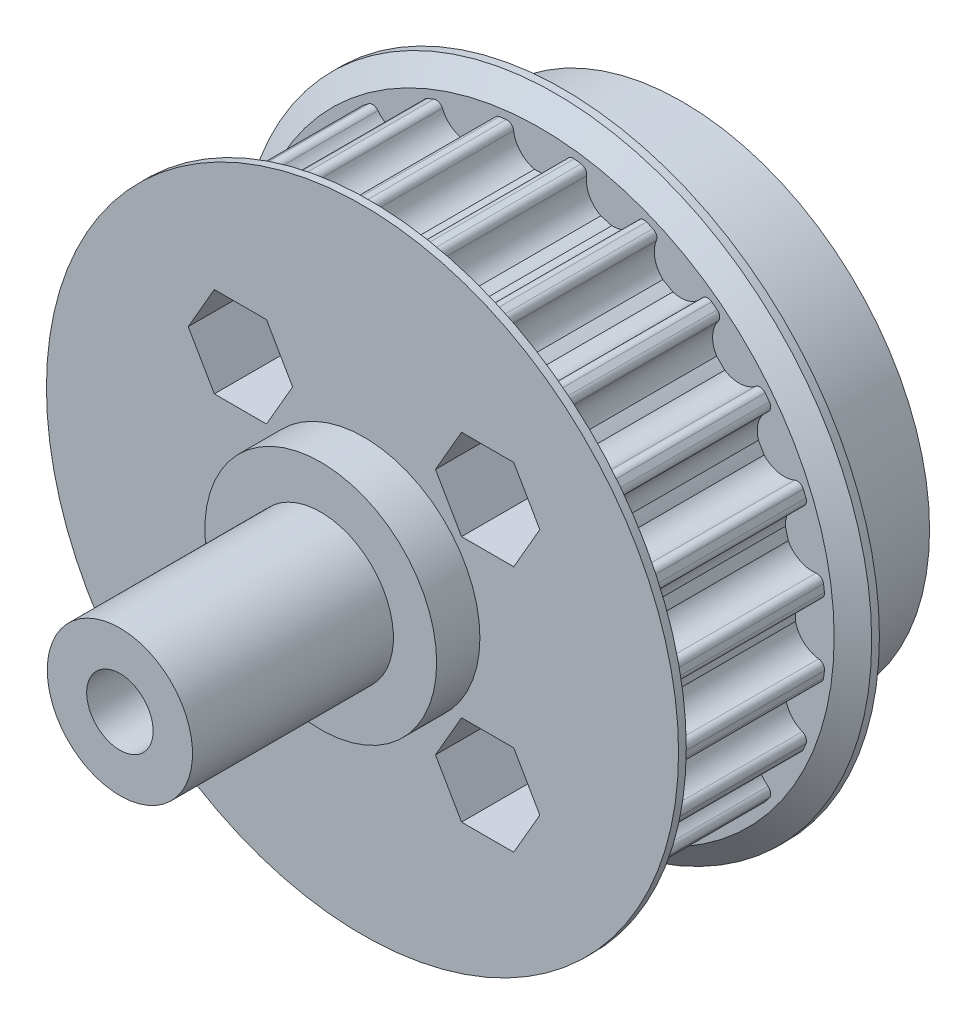
from build123d import *

# Parameters (mm, degrees)
BOSS_EXTRUDE1_START       = -6.5
BOSS_EXTRUDE1_OUTLINE_R   = 0.1
BOSS_EXTRUDE1_DEPTH       = 13
BOSS_EXTRUDE1_START_2     = 6.5
BOSS_EXTRUDE1_2_OUTLINE_R = 7.5
BOSS_EXTRUDE1_2_DEPTH     = 2.8
BOSS_EXTRUDE1_START_3     = 5.9999999
BOSS_EXTRUDE1_3_OUTLINE_R = 20.454976178
BOSS_EXTRUDE1_3_DEPTH     = 0.5000001
BOSS_EXTRUDE1_4_OUTLINE_R = 20.454976178
BOSS_EXTRUDE1_4_DEPTH     = 0.4999999
BOSS_EXTRUDE2_START       = 9.3
SKETCH1_6_R               = 4.7
SKETCH1_6_R_2             = 2.15
BOSS_EXTRUDE2_DEPTH       = 13
CUT_EXTRUDE1_START        = 22.3
SKETCH1_7_R               = 2.15
CUT_EXTRUDE1_DEPTH        = 10
BOSS_EXTRUDE3_START       = -6.5
SKETCH2_R                 = 16
SKETCH2_W                 = 9.7
SKETCH2_H                 = 9.7
SKETCH2_R_2               = 1.825
BOSS_EXTRUDE3_DEPTH       = 7.6
CUT_EXTRUDE2_DEPTH        = 37.525362433
CUT_EXTRUDE2_DEPTH_BACK   = 37.525362433
SKETCH2_3_R               = 1.825
CUT_EXTRUDE3_START        = 6.5
SKETCH2_4_R               = 1.825
CUT_EXTRUDE3_DEPTH        = 12
CUT_EXTRUDE4_START        = -14.1
SKETCH2_5_W               = 9.7
SKETCH2_5_H               = 9.7
CUT_EXTRUDE4_DEPTH        = 15


with BuildPart() as part:
    # Boss-Extrude1: read off the stored shape, not the designer's step
    # Boss-Extrude1 outline → Boss-Extrude1 (new body)
    with BuildSketch(Plane.XY.offset(BOSS_EXTRUDE1_START)):
        with BuildLine():
            ThreePointArc((-0.371183717, 16.524459806), (-1.279945959, 17.062327554), (-1.718949637, 18.022757822))
            ThreePointArc((-1.718949637, 18.022757822), (-1.880764747, 18.307950964), (-2.196580999, 18.396151608))
            ThreePointArc((-2.196580999, 18.396151608), (-2.418236335, 18.368328588), (-2.639540076, 18.337834939))
            ThreePointArc((-2.639540076, 18.337834939), (-2.921767144, 18.170900399), (-3.004255122, 17.853544145))
            ThreePointArc((-3.004255122, 17.853544145), (-3.179722466, 16.812217232), (-3.91830897, 16.057471907))
            ThreePointArc((-3.91830897, 16.057471907), (-4.27792376, 15.965428824), (-4.635380846, 15.865333077))
            ThreePointArc((-4.635380846, 15.865333077), (-5.652388183, 16.14966845), (-6.325010818, 16.963750338))
            ThreePointArc((-6.325010818, 16.963750338), (-6.555125629, 17.197344927), (-6.883008709, 17.200800946))
            ThreePointArc((-6.883008709, 17.200800946), (-7.089910196, 17.11655735), (-7.295780858, 17.029825124))
            ThreePointArc((-7.295780858, 17.029825124), (-7.525185432, 16.795532999), (-7.522724858, 16.467640938))
            ThreePointArc((-7.522724858, 16.467640938), (-7.422698061, 15.416382089), (-7.940775375, 14.496193834))
            ThreePointArc((-7.940775375, 14.496193834), (-8.264314086, 14.314211886), (-8.583684431, 14.125010117))
            ThreePointArc((-8.583684431, 14.125010117), (-9.639629493, 14.13643613), (-10.500032964, 14.748691302))
            ThreePointArc((-10.500032964, 14.748691302), (-10.782765532, 14.914768252), (-11.100370751, 14.833244125))
            ThreePointArc((-11.100370751, 14.833244125), (-11.278418392, 14.698321014), (-11.45482623, 14.56126087))
            ThreePointArc((-11.45482623, 14.56126087), (-11.61577477, 14.275577783), (-11.528533327, 13.959495216))
            ThreePointArc((-11.528533327, 13.959495216), (-11.159829049, 12.969945983), (-11.422091061, 11.947024107))
            ThreePointArc((-11.422091061, 11.947024107), (-11.687505063, 11.687505063), (-11.947024107, 11.422091061))
            ThreePointArc((-11.947024107, 11.422091061), (-12.969945983, 11.159829049), (-13.959495216, 11.528533327))
            ThreePointArc((-13.959495216, 11.528533327), (-14.275577783, 11.61577477), (-14.56126087, 11.45482623))
            ThreePointArc((-14.56126087, 11.45482623), (-14.698321014, 11.278418392), (-14.833244125, 11.100370751))
            ThreePointArc((-14.833244125, 11.100370751), (-14.914768252, 10.782765532), (-14.748691302, 10.500032964))
            ThreePointArc((-14.748691302, 10.500032964), (-14.13643613, 9.639629493), (-14.125010117, 8.583684431))
            ThreePointArc((-14.125010117, 8.583684431), (-14.314211886, 8.264314086), (-14.496193834, 7.940775375))
            ThreePointArc((-14.496193834, 7.940775375), (-15.416382089, 7.422698061), (-16.467640938, 7.522724858))
            ThreePointArc((-16.467640938, 7.522724858), (-16.795532999, 7.525185432), (-17.029825124, 7.295780858))
            ThreePointArc((-17.029825124, 7.295780858), (-17.11655735, 7.089910196), (-17.200800946, 6.883008709))
            ThreePointArc((-17.200800946, 6.883008709), (-17.197344927, 6.555125629), (-16.963750338, 6.325010818))
            ThreePointArc((-16.963750338, 6.325010818), (-16.14966845, 5.652388183), (-15.865333077, 4.635380846))
            ThreePointArc((-15.865333077, 4.635380846), (-15.965428824, 4.27792376), (-16.057471907, 3.91830897))
            ThreePointArc((-16.057471907, 3.91830897), (-16.812217232, 3.179722466), (-17.853544145, 3.004255122))
            ThreePointArc((-17.853544145, 3.004255122), (-18.170900399, 2.921767144), (-18.337834939, 2.639540076))
            ThreePointArc((-18.337834939, 2.639540076), (-18.368328588, 2.418236335), (-18.396151608, 2.196580999))
            ThreePointArc((-18.396151608, 2.196580999), (-18.307950964, 1.880764747), (-18.022757822, 1.718949637))
            ThreePointArc((-18.022757822, 1.718949637), (-17.062327554, 1.279945959), (-16.524459806, 0.371183717))
            ThreePointArc((-16.524459806, 0.371183717), (-16.528628171, 0), (-16.524459806, -0.371183717))
            ThreePointArc((-16.524459806, -0.371183717), (-17.062327554, -1.279945959), (-18.022757822, -1.718949637))
            ThreePointArc((-18.022757822, -1.718949637), (-18.307950964, -1.880764747), (-18.396151608, -2.196580999))
            ThreePointArc((-18.396151608, -2.196580999), (-18.368328588, -2.418236335), (-18.337834939, -2.639540076))
            ThreePointArc((-18.337834939, -2.639540076), (-18.170900399, -2.921767144), (-17.853544145, -3.004255122))
            ThreePointArc((-17.853544145, -3.004255122), (-16.812217232, -3.179722466), (-16.057471907, -3.91830897))
            ThreePointArc((-16.057471907, -3.91830897), (-15.965428824, -4.27792376), (-15.865333077, -4.635380846))
            ThreePointArc((-15.865333077, -4.635380846), (-16.14966845, -5.652388183), (-16.963750338, -6.325010818))
            ThreePointArc((-16.963750338, -6.325010818), (-17.197344927, -6.555125629), (-17.200800946, -6.883008709))
            ThreePointArc((-17.200800946, -6.883008709), (-17.11655735, -7.089910196), (-17.029825124, -7.295780858))
            ThreePointArc((-17.029825124, -7.295780858), (-16.795532999, -7.525185432), (-16.467640938, -7.522724858))
            ThreePointArc((-16.467640938, -7.522724858), (-15.416382089, -7.422698061), (-14.496193834, -7.940775375))
            ThreePointArc((-14.496193834, -7.940775375), (-14.314211886, -8.264314086), (-14.125010117, -8.583684431))
            ThreePointArc((-14.125010117, -8.583684431), (-14.13643613, -9.639629493), (-14.748691302, -10.500032964))
            ThreePointArc((-14.748691302, -10.500032964), (-14.914768252, -10.782765532), (-14.833244125, -11.100370751))
            ThreePointArc((-14.833244125, -11.100370751), (-14.698321014, -11.278418392), (-14.56126087, -11.45482623))
            ThreePointArc((-14.56126087, -11.45482623), (-14.275577783, -11.61577477), (-13.959495216, -11.528533327))
            ThreePointArc((-13.959495216, -11.528533327), (-12.969945983, -11.159829049), (-11.947024107, -11.422091061))
            ThreePointArc((-11.947024107, -11.422091061), (-11.687505063, -11.687505063), (-11.422091061, -11.947024107))
            ThreePointArc((-11.422091061, -11.947024107), (-11.159829049, -12.969945983), (-11.528533327, -13.959495216))
            ThreePointArc((-11.528533327, -13.959495216), (-11.61577477, -14.275577783), (-11.45482623, -14.56126087))
            ThreePointArc((-11.45482623, -14.56126087), (-11.278418392, -14.698321014), (-11.100370751, -14.833244125))
            ThreePointArc((-11.100370751, -14.833244125), (-10.782765532, -14.914768252), (-10.500032964, -14.748691302))
            ThreePointArc((-10.500032964, -14.748691302), (-9.639629493, -14.13643613), (-8.583684431, -14.125010117))
            ThreePointArc((-8.583684431, -14.125010117), (-8.264314086, -14.314211886), (-7.940775375, -14.496193834))
            ThreePointArc((-7.940775375, -14.496193834), (-7.422698061, -15.416382089), (-7.522724858, -16.467640938))
            ThreePointArc((-7.522724858, -16.467640938), (-7.525185432, -16.795532999), (-7.295780858, -17.029825124))
            ThreePointArc((-7.295780858, -17.029825124), (-7.089910196, -17.11655735), (-6.883008709, -17.200800946))
            ThreePointArc((-6.883008709, -17.200800946), (-6.555125629, -17.197344927), (-6.325010818, -16.963750338))
            ThreePointArc((-6.325010818, -16.963750338), (-5.652388183, -16.14966845), (-4.635380846, -15.865333077))
            ThreePointArc((-4.635380846, -15.865333077), (-4.27792376, -15.965428824), (-3.91830897, -16.057471907))
            ThreePointArc((-3.91830897, -16.057471907), (-3.179722466, -16.812217232), (-3.004255122, -17.853544145))
            ThreePointArc((-3.004255122, -17.853544145), (-2.921767144, -18.170900399), (-2.639540076, -18.337834939))
            ThreePointArc((-2.639540076, -18.337834939), (-2.418236335, -18.368328588), (-2.196580999, -18.396151608))
            ThreePointArc((-2.196580999, -18.396151608), (-1.880764747, -18.307950964), (-1.718949637, -18.022757822))
            ThreePointArc((-1.718949637, -18.022757822), (-1.279945959, -17.062327554), (-0.371183717, -16.524459806))
            ThreePointArc((-0.371183717, -16.524459806), (0, -16.528628171), (0.371183717, -16.524459806))
            ThreePointArc((0.371183717, -16.524459806), (1.279945959, -17.062327554), (1.718949637, -18.022757822))
            ThreePointArc((1.718949637, -18.022757822), (1.880764747, -18.307950964), (2.196580999, -18.396151608))
            ThreePointArc((2.196580999, -18.396151608), (2.418236335, -18.368328588), (2.639540076, -18.337834939))
            ThreePointArc((2.639540076, -18.337834939), (2.921767144, -18.170900399), (3.004255122, -17.853544145))
            ThreePointArc((3.004255122, -17.853544145), (3.179722466, -16.812217232), (3.91830897, -16.057471907))
            ThreePointArc((3.91830897, -16.057471907), (4.27792376, -15.965428824), (4.635380846, -15.865333077))
            ThreePointArc((4.635380846, -15.865333077), (5.652388183, -16.14966845), (6.325010818, -16.963750338))
            ThreePointArc((6.325010818, -16.963750338), (6.555125629, -17.197344927), (6.883008709, -17.200800946))
            ThreePointArc((6.883008709, -17.200800946), (7.089910196, -17.11655735), (7.295780858, -17.029825124))
            ThreePointArc((7.295780858, -17.029825124), (7.525185432, -16.795532999), (7.522724858, -16.467640938))
            ThreePointArc((7.522724858, -16.467640938), (7.422698061, -15.416382089), (7.940775375, -14.496193834))
            ThreePointArc((7.940775375, -14.496193834), (8.264314086, -14.314211886), (8.583684431, -14.125010117))
            ThreePointArc((8.583684431, -14.125010117), (9.639629493, -14.13643613), (10.500032964, -14.748691302))
            ThreePointArc((10.500032964, -14.748691302), (10.782765532, -14.914768252), (11.100370751, -14.833244125))
            ThreePointArc((11.100370751, -14.833244125), (11.278418392, -14.698321014), (11.45482623, -14.56126087))
            ThreePointArc((11.45482623, -14.56126087), (11.61577477, -14.275577783), (11.528533327, -13.959495216))
            ThreePointArc((11.528533327, -13.959495216), (11.159829049, -12.969945983), (11.422091061, -11.947024107))
            ThreePointArc((11.422091061, -11.947024107), (11.687505063, -11.687505063), (11.947024107, -11.422091061))
            ThreePointArc((11.947024107, -11.422091061), (12.969945983, -11.159829049), (13.959495216, -11.528533327))
            ThreePointArc((13.959495216, -11.528533327), (14.275577783, -11.61577477), (14.56126087, -11.45482623))
            ThreePointArc((14.56126087, -11.45482623), (14.698321014, -11.278418392), (14.833244125, -11.100370751))
            ThreePointArc((14.833244125, -11.100370751), (14.914768252, -10.782765532), (14.748691302, -10.500032964))
            ThreePointArc((14.748691302, -10.500032964), (14.13643613, -9.639629493), (14.125010117, -8.583684431))
            ThreePointArc((14.125010117, -8.583684431), (14.314211886, -8.264314086), (14.496193834, -7.940775375))
            ThreePointArc((14.496193834, -7.940775375), (15.416382089, -7.422698061), (16.467640938, -7.522724858))
            ThreePointArc((16.467640938, -7.522724858), (16.795532999, -7.525185432), (17.029825124, -7.295780858))
            ThreePointArc((17.029825124, -7.295780858), (17.11655735, -7.089910196), (17.200800946, -6.883008709))
            ThreePointArc((17.200800946, -6.883008709), (17.197344927, -6.555125629), (16.963750338, -6.325010818))
            ThreePointArc((16.963750338, -6.325010818), (16.14966845, -5.652388183), (15.865333077, -4.635380846))
            ThreePointArc((15.865333077, -4.635380846), (15.965428824, -4.27792376), (16.057471907, -3.91830897))
            ThreePointArc((16.057471907, -3.91830897), (16.812217232, -3.179722466), (17.853544145, -3.004255122))
            ThreePointArc((17.853544145, -3.004255122), (18.170900399, -2.921767144), (18.337834939, -2.639540076))
            ThreePointArc((18.337834939, -2.639540076), (18.368328588, -2.418236335), (18.396151608, -2.196580999))
            ThreePointArc((18.396151608, -2.196580999), (18.307950964, -1.880764747), (18.022757822, -1.718949637))
            ThreePointArc((18.022757822, -1.718949637), (17.062327554, -1.279945959), (16.524459806, -0.371183717))
            ThreePointArc((16.524459806, -0.371183717), (16.528628171, 0), (16.524459806, 0.371183717))
            ThreePointArc((16.524459806, 0.371183717), (17.062327554, 1.279945959), (18.022757822, 1.718949637))
            ThreePointArc((18.022757822, 1.718949637), (18.307950964, 1.880764747), (18.396151608, 2.196580999))
            ThreePointArc((18.396151608, 2.196580999), (18.368328588, 2.418236335), (18.337834939, 2.639540076))
            ThreePointArc((18.337834939, 2.639540076), (18.170900399, 2.921767144), (17.853544145, 3.004255122))
            ThreePointArc((17.853544145, 3.004255122), (16.812217232, 3.179722466), (16.057471907, 3.91830897))
            ThreePointArc((16.057471907, 3.91830897), (15.965428824, 4.27792376), (15.865333077, 4.635380846))
            ThreePointArc((15.865333077, 4.635380846), (16.14966845, 5.652388183), (16.963750338, 6.325010818))
            ThreePointArc((16.963750338, 6.325010818), (17.197344927, 6.555125629), (17.200800946, 6.883008709))
            ThreePointArc((17.200800946, 6.883008709), (17.11655735, 7.089910196), (17.029825124, 7.295780858))
            ThreePointArc((17.029825124, 7.295780858), (16.795532999, 7.525185432), (16.467640938, 7.522724858))
            ThreePointArc((16.467640938, 7.522724858), (15.416382089, 7.422698061), (14.496193834, 7.940775375))
            ThreePointArc((14.496193834, 7.940775375), (14.314211886, 8.264314086), (14.125010117, 8.583684431))
            ThreePointArc((14.125010117, 8.583684431), (14.13643613, 9.639629493), (14.748691302, 10.500032964))
            ThreePointArc((14.748691302, 10.500032964), (14.914768252, 10.782765532), (14.833244125, 11.100370751))
            ThreePointArc((14.833244125, 11.100370751), (14.698321014, 11.278418392), (14.56126087, 11.45482623))
            ThreePointArc((14.56126087, 11.45482623), (14.275577783, 11.61577477), (13.959495216, 11.528533327))
            ThreePointArc((13.959495216, 11.528533327), (12.969945983, 11.159829049), (11.947024107, 11.422091061))
            ThreePointArc((11.947024107, 11.422091061), (11.687505063, 11.687505063), (11.422091061, 11.947024107))
            ThreePointArc((11.422091061, 11.947024107), (11.159829049, 12.969945983), (11.528533327, 13.959495216))
            ThreePointArc((11.528533327, 13.959495216), (11.61577477, 14.275577783), (11.45482623, 14.56126087))
            ThreePointArc((11.45482623, 14.56126087), (11.278418392, 14.698321014), (11.100370751, 14.833244125))
            ThreePointArc((11.100370751, 14.833244125), (10.782765532, 14.914768252), (10.500032964, 14.748691302))
            ThreePointArc((10.500032964, 14.748691302), (9.639629493, 14.13643613), (8.583684431, 14.125010117))
            ThreePointArc((8.583684431, 14.125010117), (8.264314086, 14.314211886), (7.940775375, 14.496193834))
            ThreePointArc((7.940775375, 14.496193834), (7.422698061, 15.416382089), (7.522724858, 16.467640938))
            ThreePointArc((7.522724858, 16.467640938), (7.525185432, 16.795532999), (7.295780858, 17.029825124))
            ThreePointArc((7.295780858, 17.029825124), (7.089910196, 17.11655735), (6.883008709, 17.200800946))
            ThreePointArc((6.883008709, 17.200800946), (6.555125629, 17.197344927), (6.325010818, 16.963750338))
            ThreePointArc((6.325010818, 16.963750338), (5.652388183, 16.14966845), (4.635380846, 15.865333077))
            ThreePointArc((4.635380846, 15.865333077), (4.27792376, 15.965428824), (3.91830897, 16.057471907))
            ThreePointArc((3.91830897, 16.057471907), (3.179722466, 16.812217232), (3.004255122, 17.853544145))
            ThreePointArc((3.004255122, 17.853544145), (2.921767144, 18.170900399), (2.639540076, 18.337834939))
            ThreePointArc((2.639540076, 18.337834939), (2.418236335, 18.368328588), (2.196580999, 18.396151608))
            ThreePointArc((2.196580999, 18.396151608), (1.880764747, 18.307950964), (1.718949637, 18.022757822))
            ThreePointArc((1.718949637, 18.022757822), (1.279945959, 17.062327554), (0.371183717, 16.524459806))
            ThreePointArc((0.371183717, 16.524459806), (0, 16.528628171), (-0.371183717, 16.524459806))
        make_face()
        Circle(BOSS_EXTRUDE1_OUTLINE_R, mode=Mode.SUBTRACT)
    extrude(amount=BOSS_EXTRUDE1_DEPTH)

    # Boss-Extrude1 2 outline → Boss-Extrude1 2 (add)
    with BuildSketch(Plane.XY.offset(BOSS_EXTRUDE1_START_2)):
        with Locations((0.1, 0)):
            Circle(BOSS_EXTRUDE1_2_OUTLINE_R)
    extrude(amount=BOSS_EXTRUDE1_2_DEPTH)

    # Boss-Extrude1 3 outline → Boss-Extrude1 3 (add)
    with BuildSketch(Plane.XY.offset(BOSS_EXTRUDE1_START_3)):
        Circle(BOSS_EXTRUDE1_3_OUTLINE_R)
        with BuildLine():
            ThreePointArc((-2.196580999, 18.396151608), (-1.880764747, 18.307950964), (-1.718949637, 18.022757822))
            ThreePointArc((-1.718949637, 18.022757822), (-1.279945959, 17.062327554), (-0.371183717, 16.524459806))
            ThreePointArc((-0.371183717, 16.524459806), (0, 16.528628171), (0.371183717, 16.524459806))
            ThreePointArc((0.371183717, 16.524459806), (1.279945959, 17.062327554), (1.718949637, 18.022757822))
            ThreePointArc((1.718949637, 18.022757822), (1.880764747, 18.307950964), (2.196580999, 18.396151608))
            ThreePointArc((2.196580999, 18.396151608), (2.418236335, 18.368328588), (2.639540076, 18.337834939))
            ThreePointArc((2.639540076, 18.337834939), (2.921767144, 18.170900399), (3.004255122, 17.853544145))
            ThreePointArc((3.004255122, 17.853544145), (3.179722466, 16.812217232), (3.91830897, 16.057471907))
            ThreePointArc((3.91830897, 16.057471907), (4.27792376, 15.965428824), (4.635380846, 15.865333077))
            ThreePointArc((4.635380846, 15.865333077), (5.652388183, 16.14966845), (6.325010818, 16.963750338))
            ThreePointArc((6.325010818, 16.963750338), (6.555125629, 17.197344927), (6.883008709, 17.200800946))
            ThreePointArc((6.883008709, 17.200800946), (7.089910196, 17.11655735), (7.295780858, 17.029825124))
            ThreePointArc((7.295780858, 17.029825124), (7.525185432, 16.795532999), (7.522724858, 16.467640938))
            ThreePointArc((7.522724858, 16.467640938), (7.422698061, 15.416382089), (7.940775375, 14.496193834))
            ThreePointArc((7.940775375, 14.496193834), (8.264314086, 14.314211886), (8.583684431, 14.125010117))
            ThreePointArc((8.583684431, 14.125010117), (9.639629493, 14.13643613), (10.500032964, 14.748691302))
            ThreePointArc((10.500032964, 14.748691302), (10.782765532, 14.914768252), (11.100370751, 14.833244125))
            ThreePointArc((11.100370751, 14.833244125), (11.278418392, 14.698321014), (11.45482623, 14.56126087))
            ThreePointArc((11.45482623, 14.56126087), (11.61577477, 14.275577783), (11.528533327, 13.959495216))
            ThreePointArc((11.528533327, 13.959495216), (11.159829049, 12.969945983), (11.422091061, 11.947024107))
            ThreePointArc((11.422091061, 11.947024107), (11.687505063, 11.687505063), (11.947024107, 11.422091061))
            ThreePointArc((11.947024107, 11.422091061), (12.969945983, 11.159829049), (13.959495216, 11.528533327))
            ThreePointArc((13.959495216, 11.528533327), (14.275577783, 11.61577477), (14.56126087, 11.45482623))
            ThreePointArc((14.56126087, 11.45482623), (14.698321014, 11.278418392), (14.833244125, 11.100370751))
            ThreePointArc((14.833244125, 11.100370751), (14.914768252, 10.782765532), (14.748691302, 10.500032964))
            ThreePointArc((14.748691302, 10.500032964), (14.13643613, 9.639629493), (14.125010117, 8.583684431))
            ThreePointArc((14.125010117, 8.583684431), (14.314211886, 8.264314086), (14.496193834, 7.940775375))
            ThreePointArc((14.496193834, 7.940775375), (15.416382089, 7.422698061), (16.467640938, 7.522724858))
            ThreePointArc((16.467640938, 7.522724858), (16.795532999, 7.525185432), (17.029825124, 7.295780858))
            ThreePointArc((17.029825124, 7.295780858), (17.11655735, 7.089910196), (17.200800946, 6.883008709))
            ThreePointArc((17.200800946, 6.883008709), (17.197344927, 6.555125629), (16.963750338, 6.325010818))
            ThreePointArc((16.963750338, 6.325010818), (16.14966845, 5.652388183), (15.865333077, 4.635380846))
            ThreePointArc((15.865333077, 4.635380846), (15.965428824, 4.27792376), (16.057471907, 3.91830897))
            ThreePointArc((16.057471907, 3.91830897), (16.812217232, 3.179722466), (17.853544145, 3.004255122))
            ThreePointArc((17.853544145, 3.004255122), (18.170900399, 2.921767144), (18.337834939, 2.639540076))
            ThreePointArc((18.337834939, 2.639540076), (18.368328588, 2.418236335), (18.396151608, 2.196580999))
            ThreePointArc((18.396151608, 2.196580999), (18.307950964, 1.880764747), (18.022757822, 1.718949637))
            ThreePointArc((18.022757822, 1.718949637), (17.062327554, 1.279945959), (16.524459806, 0.371183717))
            ThreePointArc((16.524459806, 0.371183717), (16.528628171, 0), (16.524459806, -0.371183717))
            ThreePointArc((16.524459806, -0.371183717), (17.062327554, -1.279945959), (18.022757822, -1.718949637))
            ThreePointArc((18.022757822, -1.718949637), (18.307950964, -1.880764747), (18.396151608, -2.196580999))
            ThreePointArc((18.396151608, -2.196580999), (18.368328588, -2.418236335), (18.337834939, -2.639540076))
            ThreePointArc((18.337834939, -2.639540076), (18.170900399, -2.921767144), (17.853544145, -3.004255122))
            ThreePointArc((17.853544145, -3.004255122), (16.812217232, -3.179722466), (16.057471907, -3.91830897))
            ThreePointArc((16.057471907, -3.91830897), (15.965428824, -4.27792376), (15.865333077, -4.635380846))
            ThreePointArc((15.865333077, -4.635380846), (16.14966845, -5.652388183), (16.963750338, -6.325010818))
            ThreePointArc((16.963750338, -6.325010818), (17.197344927, -6.555125629), (17.200800946, -6.883008709))
            ThreePointArc((17.200800946, -6.883008709), (17.11655735, -7.089910196), (17.029825124, -7.295780858))
            ThreePointArc((17.029825124, -7.295780858), (16.795532999, -7.525185432), (16.467640938, -7.522724858))
            ThreePointArc((16.467640938, -7.522724858), (15.416382089, -7.422698061), (14.496193834, -7.940775375))
            ThreePointArc((14.496193834, -7.940775375), (14.314211886, -8.264314086), (14.125010117, -8.583684431))
            ThreePointArc((14.125010117, -8.583684431), (14.13643613, -9.639629493), (14.748691302, -10.500032964))
            ThreePointArc((14.748691302, -10.500032964), (14.914768252, -10.782765532), (14.833244125, -11.100370751))
            ThreePointArc((14.833244125, -11.100370751), (14.698321014, -11.278418392), (14.56126087, -11.45482623))
            ThreePointArc((14.56126087, -11.45482623), (14.275577783, -11.61577477), (13.959495216, -11.528533327))
            ThreePointArc((13.959495216, -11.528533327), (12.969945983, -11.159829049), (11.947024107, -11.422091061))
            ThreePointArc((11.947024107, -11.422091061), (11.687505063, -11.687505063), (11.422091061, -11.947024107))
            ThreePointArc((11.422091061, -11.947024107), (11.159829049, -12.969945983), (11.528533327, -13.959495216))
            ThreePointArc((11.528533327, -13.959495216), (11.61577477, -14.275577783), (11.45482623, -14.56126087))
            ThreePointArc((11.45482623, -14.56126087), (11.278418392, -14.698321014), (11.100370751, -14.833244125))
            ThreePointArc((11.100370751, -14.833244125), (10.782765532, -14.914768252), (10.500032964, -14.748691302))
            ThreePointArc((10.500032964, -14.748691302), (9.639629493, -14.13643613), (8.583684431, -14.125010117))
            ThreePointArc((8.583684431, -14.125010117), (8.264314086, -14.314211886), (7.940775375, -14.496193834))
            ThreePointArc((7.940775375, -14.496193834), (7.422698061, -15.416382089), (7.522724858, -16.467640938))
            ThreePointArc((7.522724858, -16.467640938), (7.525185432, -16.795532999), (7.295780858, -17.029825124))
            ThreePointArc((7.295780858, -17.029825124), (7.089910196, -17.11655735), (6.883008709, -17.200800946))
            ThreePointArc((6.883008709, -17.200800946), (6.555125629, -17.197344927), (6.325010818, -16.963750338))
            ThreePointArc((6.325010818, -16.963750338), (5.652388183, -16.14966845), (4.635380846, -15.865333077))
            ThreePointArc((4.635380846, -15.865333077), (4.27792376, -15.965428824), (3.91830897, -16.057471907))
            ThreePointArc((3.91830897, -16.057471907), (3.179722466, -16.812217232), (3.004255122, -17.853544145))
            ThreePointArc((3.004255122, -17.853544145), (2.921767144, -18.170900399), (2.639540076, -18.337834939))
            ThreePointArc((2.639540076, -18.337834939), (2.418236335, -18.368328588), (2.196580999, -18.396151608))
            ThreePointArc((2.196580999, -18.396151608), (1.880764747, -18.307950964), (1.718949637, -18.022757822))
            ThreePointArc((1.718949637, -18.022757822), (1.279945959, -17.062327554), (0.371183717, -16.524459806))
            ThreePointArc((0.371183717, -16.524459806), (0, -16.528628171), (-0.371183717, -16.524459806))
            ThreePointArc((-0.371183717, -16.524459806), (-1.279945959, -17.062327554), (-1.718949637, -18.022757822))
            ThreePointArc((-1.718949637, -18.022757822), (-1.880764747, -18.307950964), (-2.196580999, -18.396151608))
            ThreePointArc((-2.196580999, -18.396151608), (-2.418236335, -18.368328588), (-2.639540076, -18.337834939))
            ThreePointArc((-2.639540076, -18.337834939), (-2.921767144, -18.170900399), (-3.004255122, -17.853544145))
            ThreePointArc((-3.004255122, -17.853544145), (-3.179722466, -16.812217232), (-3.91830897, -16.057471907))
            ThreePointArc((-3.91830897, -16.057471907), (-4.27792376, -15.965428824), (-4.635380846, -15.865333077))
            ThreePointArc((-4.635380846, -15.865333077), (-5.652388183, -16.14966845), (-6.325010818, -16.963750338))
            ThreePointArc((-6.325010818, -16.963750338), (-6.555125629, -17.197344927), (-6.883008709, -17.200800946))
            ThreePointArc((-6.883008709, -17.200800946), (-7.089910196, -17.11655735), (-7.295780858, -17.029825124))
            ThreePointArc((-7.295780858, -17.029825124), (-7.525185432, -16.795532999), (-7.522724858, -16.467640938))
            ThreePointArc((-7.522724858, -16.467640938), (-7.422698061, -15.416382089), (-7.940775375, -14.496193834))
            ThreePointArc((-7.940775375, -14.496193834), (-8.264314086, -14.314211886), (-8.583684431, -14.125010117))
            ThreePointArc((-8.583684431, -14.125010117), (-9.639629493, -14.13643613), (-10.500032964, -14.748691302))
            ThreePointArc((-10.500032964, -14.748691302), (-10.782765532, -14.914768252), (-11.100370751, -14.833244125))
            ThreePointArc((-11.100370751, -14.833244125), (-11.278418392, -14.698321014), (-11.45482623, -14.56126087))
            ThreePointArc((-11.45482623, -14.56126087), (-11.61577477, -14.275577783), (-11.528533327, -13.959495216))
            ThreePointArc((-11.528533327, -13.959495216), (-11.159829049, -12.969945983), (-11.422091061, -11.947024107))
            ThreePointArc((-11.422091061, -11.947024107), (-11.687505063, -11.687505063), (-11.947024107, -11.422091061))
            ThreePointArc((-11.947024107, -11.422091061), (-12.969945983, -11.159829049), (-13.959495216, -11.528533327))
            ThreePointArc((-13.959495216, -11.528533327), (-14.275577783, -11.61577477), (-14.56126087, -11.45482623))
            ThreePointArc((-14.56126087, -11.45482623), (-14.698321014, -11.278418392), (-14.833244125, -11.100370751))
            ThreePointArc((-14.833244125, -11.100370751), (-14.914768252, -10.782765532), (-14.748691302, -10.500032964))
            ThreePointArc((-14.748691302, -10.500032964), (-14.13643613, -9.639629493), (-14.125010117, -8.583684431))
            ThreePointArc((-14.125010117, -8.583684431), (-14.314211886, -8.264314086), (-14.496193834, -7.940775375))
            ThreePointArc((-14.496193834, -7.940775375), (-15.416382089, -7.422698061), (-16.467640938, -7.522724858))
            ThreePointArc((-16.467640938, -7.522724858), (-16.795532999, -7.525185432), (-17.029825124, -7.295780858))
            ThreePointArc((-17.029825124, -7.295780858), (-17.11655735, -7.089910196), (-17.200800946, -6.883008709))
            ThreePointArc((-17.200800946, -6.883008709), (-17.197344927, -6.555125629), (-16.963750338, -6.325010818))
            ThreePointArc((-16.963750338, -6.325010818), (-16.14966845, -5.652388183), (-15.865333077, -4.635380846))
            ThreePointArc((-15.865333077, -4.635380846), (-15.965428824, -4.27792376), (-16.057471907, -3.91830897))
            ThreePointArc((-16.057471907, -3.91830897), (-16.812217232, -3.179722466), (-17.853544145, -3.004255122))
            ThreePointArc((-17.853544145, -3.004255122), (-18.170900399, -2.921767144), (-18.337834939, -2.639540076))
            ThreePointArc((-18.337834939, -2.639540076), (-18.368328588, -2.418236335), (-18.396151608, -2.196580999))
            ThreePointArc((-18.396151608, -2.196580999), (-18.307950964, -1.880764747), (-18.022757822, -1.718949637))
            ThreePointArc((-18.022757822, -1.718949637), (-17.062327554, -1.279945959), (-16.524459806, -0.371183717))
            ThreePointArc((-16.524459806, -0.371183717), (-16.528628171, 0), (-16.524459806, 0.371183717))
            ThreePointArc((-16.524459806, 0.371183717), (-17.062327554, 1.279945959), (-18.022757822, 1.718949637))
            ThreePointArc((-18.022757822, 1.718949637), (-18.307950964, 1.880764747), (-18.396151608, 2.196580999))
            ThreePointArc((-18.396151608, 2.196580999), (-18.368328588, 2.418236335), (-18.337834939, 2.639540076))
            ThreePointArc((-18.337834939, 2.639540076), (-18.170900399, 2.921767144), (-17.853544145, 3.004255122))
            ThreePointArc((-17.853544145, 3.004255122), (-16.812217232, 3.179722466), (-16.057471907, 3.91830897))
            ThreePointArc((-16.057471907, 3.91830897), (-15.965428824, 4.27792376), (-15.865333077, 4.635380846))
            ThreePointArc((-15.865333077, 4.635380846), (-16.14966845, 5.652388183), (-16.963750338, 6.325010818))
            ThreePointArc((-16.963750338, 6.325010818), (-17.197344927, 6.555125629), (-17.200800946, 6.883008709))
            ThreePointArc((-17.200800946, 6.883008709), (-17.11655735, 7.089910196), (-17.029825124, 7.295780858))
            ThreePointArc((-17.029825124, 7.295780858), (-16.795532999, 7.525185432), (-16.467640938, 7.522724858))
            ThreePointArc((-16.467640938, 7.522724858), (-15.416382089, 7.422698061), (-14.496193834, 7.940775375))
            ThreePointArc((-14.496193834, 7.940775375), (-14.314211886, 8.264314086), (-14.125010117, 8.583684431))
            ThreePointArc((-14.125010117, 8.583684431), (-14.13643613, 9.639629493), (-14.748691302, 10.500032964))
            ThreePointArc((-14.748691302, 10.500032964), (-14.914768252, 10.782765532), (-14.833244125, 11.100370751))
            ThreePointArc((-14.833244125, 11.100370751), (-14.698321014, 11.278418392), (-14.56126087, 11.45482623))
            ThreePointArc((-14.56126087, 11.45482623), (-14.275577783, 11.61577477), (-13.959495216, 11.528533327))
            ThreePointArc((-13.959495216, 11.528533327), (-12.969945983, 11.159829049), (-11.947024107, 11.422091061))
            ThreePointArc((-11.947024107, 11.422091061), (-11.687505063, 11.687505063), (-11.422091061, 11.947024107))
            ThreePointArc((-11.422091061, 11.947024107), (-11.159829049, 12.969945983), (-11.528533327, 13.959495216))
            ThreePointArc((-11.528533327, 13.959495216), (-11.61577477, 14.275577783), (-11.45482623, 14.56126087))
            ThreePointArc((-11.45482623, 14.56126087), (-11.278418392, 14.698321014), (-11.100370751, 14.833244125))
            ThreePointArc((-11.100370751, 14.833244125), (-10.782765532, 14.914768252), (-10.500032964, 14.748691302))
            ThreePointArc((-10.500032964, 14.748691302), (-9.639629493, 14.13643613), (-8.583684431, 14.125010117))
            ThreePointArc((-8.583684431, 14.125010117), (-8.264314086, 14.314211886), (-7.940775375, 14.496193834))
            ThreePointArc((-7.940775375, 14.496193834), (-7.422698061, 15.416382089), (-7.522724858, 16.467640938))
            ThreePointArc((-7.522724858, 16.467640938), (-7.525185432, 16.795532999), (-7.295780858, 17.029825124))
            ThreePointArc((-7.295780858, 17.029825124), (-7.089910196, 17.11655735), (-6.883008709, 17.200800946))
            ThreePointArc((-6.883008709, 17.200800946), (-6.555125629, 17.197344927), (-6.325010818, 16.963750338))
            ThreePointArc((-6.325010818, 16.963750338), (-5.652388183, 16.14966845), (-4.635380846, 15.865333077))
            ThreePointArc((-4.635380846, 15.865333077), (-4.27792376, 15.965428824), (-3.91830897, 16.057471907))
            ThreePointArc((-3.91830897, 16.057471907), (-3.179722466, 16.812217232), (-3.004255122, 17.853544145))
            ThreePointArc((-3.004255122, 17.853544145), (-2.921767144, 18.170900399), (-2.639540076, 18.337834939))
            ThreePointArc((-2.639540076, 18.337834939), (-2.418236335, 18.368328588), (-2.196580999, 18.396151608))
        make_face(mode=Mode.SUBTRACT)
    extrude(amount=BOSS_EXTRUDE1_3_DEPTH)

    # Boss-Extrude1 4 outline → Boss-Extrude1 4 (add)
    with BuildSketch(Plane.XY.offset(BOSS_EXTRUDE1_START)):
        Circle(BOSS_EXTRUDE1_4_OUTLINE_R)
        with BuildLine():
            ThreePointArc((-2.196580999, 18.396151608), (-1.880764747, 18.307950964), (-1.718949637, 18.022757822))
            ThreePointArc((-1.718949637, 18.022757822), (-1.279945959, 17.062327554), (-0.371183717, 16.524459806))
            ThreePointArc((-0.371183717, 16.524459806), (0, 16.528628171), (0.371183717, 16.524459806))
            ThreePointArc((0.371183717, 16.524459806), (1.279945959, 17.062327554), (1.718949637, 18.022757822))
            ThreePointArc((1.718949637, 18.022757822), (1.880764747, 18.307950964), (2.196580999, 18.396151608))
            ThreePointArc((2.196580999, 18.396151608), (2.418236335, 18.368328588), (2.639540076, 18.337834939))
            ThreePointArc((2.639540076, 18.337834939), (2.921767144, 18.170900399), (3.004255122, 17.853544145))
            ThreePointArc((3.004255122, 17.853544145), (3.179722466, 16.812217232), (3.91830897, 16.057471907))
            ThreePointArc((3.91830897, 16.057471907), (4.27792376, 15.965428824), (4.635380846, 15.865333077))
            ThreePointArc((4.635380846, 15.865333077), (5.652388183, 16.14966845), (6.325010818, 16.963750338))
            ThreePointArc((6.325010818, 16.963750338), (6.555125629, 17.197344927), (6.883008709, 17.200800946))
            ThreePointArc((6.883008709, 17.200800946), (7.089910196, 17.11655735), (7.295780858, 17.029825124))
            ThreePointArc((7.295780858, 17.029825124), (7.525185432, 16.795532999), (7.522724858, 16.467640938))
            ThreePointArc((7.522724858, 16.467640938), (7.422698061, 15.416382089), (7.940775375, 14.496193834))
            ThreePointArc((7.940775375, 14.496193834), (8.264314086, 14.314211886), (8.583684431, 14.125010117))
            ThreePointArc((8.583684431, 14.125010117), (9.639629493, 14.13643613), (10.500032964, 14.748691302))
            ThreePointArc((10.500032964, 14.748691302), (10.782765532, 14.914768252), (11.100370751, 14.833244125))
            ThreePointArc((11.100370751, 14.833244125), (11.278418392, 14.698321014), (11.45482623, 14.56126087))
            ThreePointArc((11.45482623, 14.56126087), (11.61577477, 14.275577783), (11.528533327, 13.959495216))
            ThreePointArc((11.528533327, 13.959495216), (11.159829049, 12.969945983), (11.422091061, 11.947024107))
            ThreePointArc((11.422091061, 11.947024107), (11.687505063, 11.687505063), (11.947024107, 11.422091061))
            ThreePointArc((11.947024107, 11.422091061), (12.969945983, 11.159829049), (13.959495216, 11.528533327))
            ThreePointArc((13.959495216, 11.528533327), (14.275577783, 11.61577477), (14.56126087, 11.45482623))
            ThreePointArc((14.56126087, 11.45482623), (14.698321014, 11.278418392), (14.833244125, 11.100370751))
            ThreePointArc((14.833244125, 11.100370751), (14.914768252, 10.782765532), (14.748691302, 10.500032964))
            ThreePointArc((14.748691302, 10.500032964), (14.13643613, 9.639629493), (14.125010117, 8.583684431))
            ThreePointArc((14.125010117, 8.583684431), (14.314211886, 8.264314086), (14.496193834, 7.940775375))
            ThreePointArc((14.496193834, 7.940775375), (15.416382089, 7.422698061), (16.467640938, 7.522724858))
            ThreePointArc((16.467640938, 7.522724858), (16.795532999, 7.525185432), (17.029825124, 7.295780858))
            ThreePointArc((17.029825124, 7.295780858), (17.11655735, 7.089910196), (17.200800946, 6.883008709))
            ThreePointArc((17.200800946, 6.883008709), (17.197344927, 6.555125629), (16.963750338, 6.325010818))
            ThreePointArc((16.963750338, 6.325010818), (16.14966845, 5.652388183), (15.865333077, 4.635380846))
            ThreePointArc((15.865333077, 4.635380846), (15.965428824, 4.27792376), (16.057471907, 3.91830897))
            ThreePointArc((16.057471907, 3.91830897), (16.812217232, 3.179722466), (17.853544145, 3.004255122))
            ThreePointArc((17.853544145, 3.004255122), (18.170900399, 2.921767144), (18.337834939, 2.639540076))
            ThreePointArc((18.337834939, 2.639540076), (18.368328588, 2.418236335), (18.396151608, 2.196580999))
            ThreePointArc((18.396151608, 2.196580999), (18.307950964, 1.880764747), (18.022757822, 1.718949637))
            ThreePointArc((18.022757822, 1.718949637), (17.062327554, 1.279945959), (16.524459806, 0.371183717))
            ThreePointArc((16.524459806, 0.371183717), (16.528628171, 0), (16.524459806, -0.371183717))
            ThreePointArc((16.524459806, -0.371183717), (17.062327554, -1.279945959), (18.022757822, -1.718949637))
            ThreePointArc((18.022757822, -1.718949637), (18.307950964, -1.880764747), (18.396151608, -2.196580999))
            ThreePointArc((18.396151608, -2.196580999), (18.368328588, -2.418236335), (18.337834939, -2.639540076))
            ThreePointArc((18.337834939, -2.639540076), (18.170900399, -2.921767144), (17.853544145, -3.004255122))
            ThreePointArc((17.853544145, -3.004255122), (16.812217232, -3.179722466), (16.057471907, -3.91830897))
            ThreePointArc((16.057471907, -3.91830897), (15.965428824, -4.27792376), (15.865333077, -4.635380846))
            ThreePointArc((15.865333077, -4.635380846), (16.14966845, -5.652388183), (16.963750338, -6.325010818))
            ThreePointArc((16.963750338, -6.325010818), (17.197344927, -6.555125629), (17.200800946, -6.883008709))
            ThreePointArc((17.200800946, -6.883008709), (17.11655735, -7.089910196), (17.029825124, -7.295780858))
            ThreePointArc((17.029825124, -7.295780858), (16.795532999, -7.525185432), (16.467640938, -7.522724858))
            ThreePointArc((16.467640938, -7.522724858), (15.416382089, -7.422698061), (14.496193834, -7.940775375))
            ThreePointArc((14.496193834, -7.940775375), (14.314211886, -8.264314086), (14.125010117, -8.583684431))
            ThreePointArc((14.125010117, -8.583684431), (14.13643613, -9.639629493), (14.748691302, -10.500032964))
            ThreePointArc((14.748691302, -10.500032964), (14.914768252, -10.782765532), (14.833244125, -11.100370751))
            ThreePointArc((14.833244125, -11.100370751), (14.698321014, -11.278418392), (14.56126087, -11.45482623))
            ThreePointArc((14.56126087, -11.45482623), (14.275577783, -11.61577477), (13.959495216, -11.528533327))
            ThreePointArc((13.959495216, -11.528533327), (12.969945983, -11.159829049), (11.947024107, -11.422091061))
            ThreePointArc((11.947024107, -11.422091061), (11.687505063, -11.687505063), (11.422091061, -11.947024107))
            ThreePointArc((11.422091061, -11.947024107), (11.159829049, -12.969945983), (11.528533327, -13.959495216))
            ThreePointArc((11.528533327, -13.959495216), (11.61577477, -14.275577783), (11.45482623, -14.56126087))
            ThreePointArc((11.45482623, -14.56126087), (11.278418392, -14.698321014), (11.100370751, -14.833244125))
            ThreePointArc((11.100370751, -14.833244125), (10.782765532, -14.914768252), (10.500032964, -14.748691302))
            ThreePointArc((10.500032964, -14.748691302), (9.639629493, -14.13643613), (8.583684431, -14.125010117))
            ThreePointArc((8.583684431, -14.125010117), (8.264314086, -14.314211886), (7.940775375, -14.496193834))
            ThreePointArc((7.940775375, -14.496193834), (7.422698061, -15.416382089), (7.522724858, -16.467640938))
            ThreePointArc((7.522724858, -16.467640938), (7.525185432, -16.795532999), (7.295780858, -17.029825124))
            ThreePointArc((7.295780858, -17.029825124), (7.089910196, -17.11655735), (6.883008709, -17.200800946))
            ThreePointArc((6.883008709, -17.200800946), (6.555125629, -17.197344927), (6.325010818, -16.963750338))
            ThreePointArc((6.325010818, -16.963750338), (5.652388183, -16.14966845), (4.635380846, -15.865333077))
            ThreePointArc((4.635380846, -15.865333077), (4.27792376, -15.965428824), (3.91830897, -16.057471907))
            ThreePointArc((3.91830897, -16.057471907), (3.179722466, -16.812217232), (3.004255122, -17.853544145))
            ThreePointArc((3.004255122, -17.853544145), (2.921767144, -18.170900399), (2.639540076, -18.337834939))
            ThreePointArc((2.639540076, -18.337834939), (2.418236335, -18.368328588), (2.196580999, -18.396151608))
            ThreePointArc((2.196580999, -18.396151608), (1.880764747, -18.307950964), (1.718949637, -18.022757822))
            ThreePointArc((1.718949637, -18.022757822), (1.279945959, -17.062327554), (0.371183717, -16.524459806))
            ThreePointArc((0.371183717, -16.524459806), (0, -16.528628171), (-0.371183717, -16.524459806))
            ThreePointArc((-0.371183717, -16.524459806), (-1.279945959, -17.062327554), (-1.718949637, -18.022757822))
            ThreePointArc((-1.718949637, -18.022757822), (-1.880764747, -18.307950964), (-2.196580999, -18.396151608))
            ThreePointArc((-2.196580999, -18.396151608), (-2.418236335, -18.368328588), (-2.639540076, -18.337834939))
            ThreePointArc((-2.639540076, -18.337834939), (-2.921767144, -18.170900399), (-3.004255122, -17.853544145))
            ThreePointArc((-3.004255122, -17.853544145), (-3.179722466, -16.812217232), (-3.91830897, -16.057471907))
            ThreePointArc((-3.91830897, -16.057471907), (-4.27792376, -15.965428824), (-4.635380846, -15.865333077))
            ThreePointArc((-4.635380846, -15.865333077), (-5.652388183, -16.14966845), (-6.325010818, -16.963750338))
            ThreePointArc((-6.325010818, -16.963750338), (-6.555125629, -17.197344927), (-6.883008709, -17.200800946))
            ThreePointArc((-6.883008709, -17.200800946), (-7.089910196, -17.11655735), (-7.295780858, -17.029825124))
            ThreePointArc((-7.295780858, -17.029825124), (-7.525185432, -16.795532999), (-7.522724858, -16.467640938))
            ThreePointArc((-7.522724858, -16.467640938), (-7.422698061, -15.416382089), (-7.940775375, -14.496193834))
            ThreePointArc((-7.940775375, -14.496193834), (-8.264314086, -14.314211886), (-8.583684431, -14.125010117))
            ThreePointArc((-8.583684431, -14.125010117), (-9.639629493, -14.13643613), (-10.500032964, -14.748691302))
            ThreePointArc((-10.500032964, -14.748691302), (-10.782765532, -14.914768252), (-11.100370751, -14.833244125))
            ThreePointArc((-11.100370751, -14.833244125), (-11.278418392, -14.698321014), (-11.45482623, -14.56126087))
            ThreePointArc((-11.45482623, -14.56126087), (-11.61577477, -14.275577783), (-11.528533327, -13.959495216))
            ThreePointArc((-11.528533327, -13.959495216), (-11.159829049, -12.969945983), (-11.422091061, -11.947024107))
            ThreePointArc((-11.422091061, -11.947024107), (-11.687505063, -11.687505063), (-11.947024107, -11.422091061))
            ThreePointArc((-11.947024107, -11.422091061), (-12.969945983, -11.159829049), (-13.959495216, -11.528533327))
            ThreePointArc((-13.959495216, -11.528533327), (-14.275577783, -11.61577477), (-14.56126087, -11.45482623))
            ThreePointArc((-14.56126087, -11.45482623), (-14.698321014, -11.278418392), (-14.833244125, -11.100370751))
            ThreePointArc((-14.833244125, -11.100370751), (-14.914768252, -10.782765532), (-14.748691302, -10.500032964))
            ThreePointArc((-14.748691302, -10.500032964), (-14.13643613, -9.639629493), (-14.125010117, -8.583684431))
            ThreePointArc((-14.125010117, -8.583684431), (-14.314211886, -8.264314086), (-14.496193834, -7.940775375))
            ThreePointArc((-14.496193834, -7.940775375), (-15.416382089, -7.422698061), (-16.467640938, -7.522724858))
            ThreePointArc((-16.467640938, -7.522724858), (-16.795532999, -7.525185432), (-17.029825124, -7.295780858))
            ThreePointArc((-17.029825124, -7.295780858), (-17.11655735, -7.089910196), (-17.200800946, -6.883008709))
            ThreePointArc((-17.200800946, -6.883008709), (-17.197344927, -6.555125629), (-16.963750338, -6.325010818))
            ThreePointArc((-16.963750338, -6.325010818), (-16.14966845, -5.652388183), (-15.865333077, -4.635380846))
            ThreePointArc((-15.865333077, -4.635380846), (-15.965428824, -4.27792376), (-16.057471907, -3.91830897))
            ThreePointArc((-16.057471907, -3.91830897), (-16.812217232, -3.179722466), (-17.853544145, -3.004255122))
            ThreePointArc((-17.853544145, -3.004255122), (-18.170900399, -2.921767144), (-18.337834939, -2.639540076))
            ThreePointArc((-18.337834939, -2.639540076), (-18.368328588, -2.418236335), (-18.396151608, -2.196580999))
            ThreePointArc((-18.396151608, -2.196580999), (-18.307950964, -1.880764747), (-18.022757822, -1.718949637))
            ThreePointArc((-18.022757822, -1.718949637), (-17.062327554, -1.279945959), (-16.524459806, -0.371183717))
            ThreePointArc((-16.524459806, -0.371183717), (-16.528628171, 0), (-16.524459806, 0.371183717))
            ThreePointArc((-16.524459806, 0.371183717), (-17.062327554, 1.279945959), (-18.022757822, 1.718949637))
            ThreePointArc((-18.022757822, 1.718949637), (-18.307950964, 1.880764747), (-18.396151608, 2.196580999))
            ThreePointArc((-18.396151608, 2.196580999), (-18.368328588, 2.418236335), (-18.337834939, 2.639540076))
            ThreePointArc((-18.337834939, 2.639540076), (-18.170900399, 2.921767144), (-17.853544145, 3.004255122))
            ThreePointArc((-17.853544145, 3.004255122), (-16.812217232, 3.179722466), (-16.057471907, 3.91830897))
            ThreePointArc((-16.057471907, 3.91830897), (-15.965428824, 4.27792376), (-15.865333077, 4.635380846))
            ThreePointArc((-15.865333077, 4.635380846), (-16.14966845, 5.652388183), (-16.963750338, 6.325010818))
            ThreePointArc((-16.963750338, 6.325010818), (-17.197344927, 6.555125629), (-17.200800946, 6.883008709))
            ThreePointArc((-17.200800946, 6.883008709), (-17.11655735, 7.089910196), (-17.029825124, 7.295780858))
            ThreePointArc((-17.029825124, 7.295780858), (-16.795532999, 7.525185432), (-16.467640938, 7.522724858))
            ThreePointArc((-16.467640938, 7.522724858), (-15.416382089, 7.422698061), (-14.496193834, 7.940775375))
            ThreePointArc((-14.496193834, 7.940775375), (-14.314211886, 8.264314086), (-14.125010117, 8.583684431))
            ThreePointArc((-14.125010117, 8.583684431), (-14.13643613, 9.639629493), (-14.748691302, 10.500032964))
            ThreePointArc((-14.748691302, 10.500032964), (-14.914768252, 10.782765532), (-14.833244125, 11.100370751))
            ThreePointArc((-14.833244125, 11.100370751), (-14.698321014, 11.278418392), (-14.56126087, 11.45482623))
            ThreePointArc((-14.56126087, 11.45482623), (-14.275577783, 11.61577477), (-13.959495216, 11.528533327))
            ThreePointArc((-13.959495216, 11.528533327), (-12.969945983, 11.159829049), (-11.947024107, 11.422091061))
            ThreePointArc((-11.947024107, 11.422091061), (-11.687505063, 11.687505063), (-11.422091061, 11.947024107))
            ThreePointArc((-11.422091061, 11.947024107), (-11.159829049, 12.969945983), (-11.528533327, 13.959495216))
            ThreePointArc((-11.528533327, 13.959495216), (-11.61577477, 14.275577783), (-11.45482623, 14.56126087))
            ThreePointArc((-11.45482623, 14.56126087), (-11.278418392, 14.698321014), (-11.100370751, 14.833244125))
            ThreePointArc((-11.100370751, 14.833244125), (-10.782765532, 14.914768252), (-10.500032964, 14.748691302))
            ThreePointArc((-10.500032964, 14.748691302), (-9.639629493, 14.13643613), (-8.583684431, 14.125010117))
            ThreePointArc((-8.583684431, 14.125010117), (-8.264314086, 14.314211886), (-7.940775375, 14.496193834))
            ThreePointArc((-7.940775375, 14.496193834), (-7.422698061, 15.416382089), (-7.522724858, 16.467640938))
            ThreePointArc((-7.522724858, 16.467640938), (-7.525185432, 16.795532999), (-7.295780858, 17.029825124))
            ThreePointArc((-7.295780858, 17.029825124), (-7.089910196, 17.11655735), (-6.883008709, 17.200800946))
            ThreePointArc((-6.883008709, 17.200800946), (-6.555125629, 17.197344927), (-6.325010818, 16.963750338))
            ThreePointArc((-6.325010818, 16.963750338), (-5.652388183, 16.14966845), (-4.635380846, 15.865333077))
            ThreePointArc((-4.635380846, 15.865333077), (-4.27792376, 15.965428824), (-3.91830897, 16.057471907))
            ThreePointArc((-3.91830897, 16.057471907), (-3.179722466, 16.812217232), (-3.004255122, 17.853544145))
            ThreePointArc((-3.004255122, 17.853544145), (-2.921767144, 18.170900399), (-2.639540076, 18.337834939))
            ThreePointArc((-2.639540076, 18.337834939), (-2.418236335, 18.368328588), (-2.196580999, 18.396151608))
        make_face(mode=Mode.SUBTRACT)
    extrude(amount=BOSS_EXTRUDE1_4_DEPTH)

    # Boss-Extrude1 5 outline → Boss-Extrude1 5 (revolve)
    with BuildSketch(Plane.XZ):
        Polygon((20.454976178, -6), (19.026828171, -5), (16.528628171, -5), (16.528628171, -6.0000001), align=None)
        Polygon((16.528628171, 6), (16.528628171, 5), (19.026828171, 5), (20.454976178, 6), align=None)
    revolve(axis=Axis((0, 0, 0), (0, 0, 1)))

    # Sketch1<6> → Boss-Extrude2 (add)
    # profile 1 of 2: a face of its own
    with BuildSketch(Plane.XY.offset(BOSS_EXTRUDE2_START)):
        with Locations(Location((0.1, 0, 0), (0, 0, 180))):
            Circle(SKETCH1_6_R)
        with Locations((0.1, 0)):
            Circle(SKETCH1_6_R_2, mode=Mode.SUBTRACT)
    # profile 2 of 2: a face of its own
    with BuildSketch(Plane.XY.offset(BOSS_EXTRUDE2_START)):
        with Locations((0.1, 0)):
            Circle(SKETCH1_6_R_2)
    extrude(amount=BOSS_EXTRUDE2_DEPTH)

    # Sketch1<7> → Cut-Extrude1 (cut)
    with BuildSketch(Plane.XY.offset(CUT_EXTRUDE1_START)):
        with Locations((0.1, 0)):
            Circle(SKETCH1_7_R)
    extrude(amount=-CUT_EXTRUDE1_DEPTH, mode=Mode.SUBTRACT)

    # Sketch2 → Boss-Extrude3 (add)
    # profile 1 of 10: a face of its own
    with BuildSketch(Plane.XY.offset(BOSS_EXTRUDE3_START)):
        with Locations((0.1, 0)):
            Circle(SKETCH2_R)
        with Locations((0.1, 0)):
            Rectangle(SKETCH2_W, SKETCH2_H, mode=Mode.SUBTRACT)
        Polygon((-6.211250463, 5.075), (-4.522500925, 8), (-6.211250463, 10.925), (-9.588749537, 10.925), (-11.277499075, 8), (-9.588749537, 5.075), align=None, mode=Mode.SUBTRACT)
    # profile 2 of 10: a face of its own
    with BuildSketch(Plane.XY.offset(BOSS_EXTRUDE3_START)):
        with Locations((0.1, 0)):
            Rectangle(SKETCH2_W, SKETCH2_H)
    # profile 3 of 10: a face of its own
    with BuildSketch(Plane.XY.offset(BOSS_EXTRUDE3_START)):
        Polygon((-9.588749537, 5.075), (-6.211250463, 5.075), (-4.522500925, 8), (-6.211250463, 10.925), (-9.588749537, 10.925), (-11.277499075, 8), align=None)
        with Locations((-7.9, 8)):
            Circle(SKETCH2_R_2, mode=Mode.SUBTRACT)
    # profile 4 of 10: a face of its own
    with BuildSketch(Plane.XY.offset(BOSS_EXTRUDE3_START)):
        with Locations((-7.9, 8)):
            Circle(SKETCH2_R_2)
    # profile 5 of 10: a face of its own
    with BuildSketch(Plane.XY.offset(BOSS_EXTRUDE3_START)):
        Polygon((-11.277499075, -8), (-9.588749537, -10.925), (-6.211250463, -10.925), (-4.522500925, -8), (-6.211250463, -5.075), (-9.588749537, -5.075), align=None)
        with Locations((-7.9, -8)):
            Circle(SKETCH2_R_2, mode=Mode.SUBTRACT)
    # profile 6 of 10: a face of its own
    with BuildSketch(Plane.XY.offset(BOSS_EXTRUDE3_START)):
        with Locations((-7.9, -8)):
            Circle(SKETCH2_R_2)
    # profile 7 of 10: a face of its own
    with BuildSketch(Plane.XY.offset(BOSS_EXTRUDE3_START)):
        Polygon((4.722500925, -8), (6.411250463, -10.925), (9.788749537, -10.925), (11.477499075, -8), (9.788749537, -5.075), (6.411250463, -5.075), align=None)
        with Locations((8.1, -8)):
            Circle(SKETCH2_R_2, mode=Mode.SUBTRACT)
    # profile 8 of 10: a face of its own
    with BuildSketch(Plane.XY.offset(BOSS_EXTRUDE3_START)):
        with Locations((8.1, -8)):
            Circle(SKETCH2_R_2)
    # profile 9 of 10: a face of its own
    with BuildSketch(Plane.XY.offset(BOSS_EXTRUDE3_START)):
        Polygon((4.722500925, 8), (6.411250463, 5.075), (9.788749537, 5.075), (11.477499075, 8), (9.788749537, 10.925), (6.411250463, 10.925), align=None)
        with Locations((8.1, 8)):
            Circle(SKETCH2_R_2, mode=Mode.SUBTRACT)
    # profile 10 of 10: a face of its own
    with BuildSketch(Plane.XY.offset(BOSS_EXTRUDE3_START)):
        with Locations((8.1, 8)):
            Circle(SKETCH2_R_2)
    extrude(amount=-BOSS_EXTRUDE3_DEPTH)

    # Sketch2<3> → Cut-Extrude2 (cut, two sides: drawn at the far end of the back side and taken through both)
    with BuildSketch(Plane.XY.offset(-CUT_EXTRUDE2_DEPTH_BACK)):
        with Locations((-7.9, 8)):
            Circle(SKETCH2_3_R)
        with Locations((8.1, 8)):
            Circle(SKETCH2_3_R)
        with Locations((8.1, -8)):
            Circle(SKETCH2_3_R)
        with Locations((-7.9, -8)):
            Circle(SKETCH2_3_R)
    extrude(amount=CUT_EXTRUDE2_DEPTH + CUT_EXTRUDE2_DEPTH_BACK, mode=Mode.SUBTRACT)

    # Sketch2<4> → Cut-Extrude3 (cut)
    # profile 1 of 4: a face of its own
    with BuildSketch(Plane.XY.offset(CUT_EXTRUDE3_START)):
        Polygon((-9.588749537, 5.075), (-6.211250463, 5.075), (-4.522500925, 8), (-6.211250463, 10.925), (-9.588749537, 10.925), (-11.277499075, 8), align=None)
        with Locations((-7.9, 8)):
            Circle(SKETCH2_4_R, mode=Mode.SUBTRACT)
    # profile 2 of 4: a face of its own
    with BuildSketch(Plane.XY.offset(CUT_EXTRUDE3_START)):
        Polygon((4.722500925, 8), (6.411250463, 5.075), (9.788749537, 5.075), (11.477499075, 8), (9.788749537, 10.925), (6.411250463, 10.925), align=None)
        with Locations((8.1, 8)):
            Circle(SKETCH2_4_R, mode=Mode.SUBTRACT)
    # profile 3 of 4: a face of its own
    with BuildSketch(Plane.XY.offset(CUT_EXTRUDE3_START)):
        Polygon((-11.277499075, -8), (-9.588749537, -10.925), (-6.211250463, -10.925), (-4.522500925, -8), (-6.211250463, -5.075), (-9.588749537, -5.075), align=None)
        with Locations((-7.9, -8)):
            Circle(SKETCH2_4_R, mode=Mode.SUBTRACT)
    # profile 4 of 4: a face of its own
    with BuildSketch(Plane.XY.offset(CUT_EXTRUDE3_START)):
        Polygon((4.722500925, -8), (6.411250463, -10.925), (9.788749537, -10.925), (11.477499075, -8), (9.788749537, -5.075), (6.411250463, -5.075), align=None)
        with Locations((8.1, -8)):
            Circle(SKETCH2_4_R, mode=Mode.SUBTRACT)
    extrude(amount=-CUT_EXTRUDE3_DEPTH, mode=Mode.SUBTRACT)

    # Sketch2<5> → Cut-Extrude4 (cut)
    with BuildSketch(Plane.XY.offset(CUT_EXTRUDE4_START)):
        with Locations((0.1, 0)):
            Rectangle(SKETCH2_5_W, SKETCH2_5_H)
    extrude(amount=CUT_EXTRUDE4_DEPTH, mode=Mode.SUBTRACT)


solid = part.part
